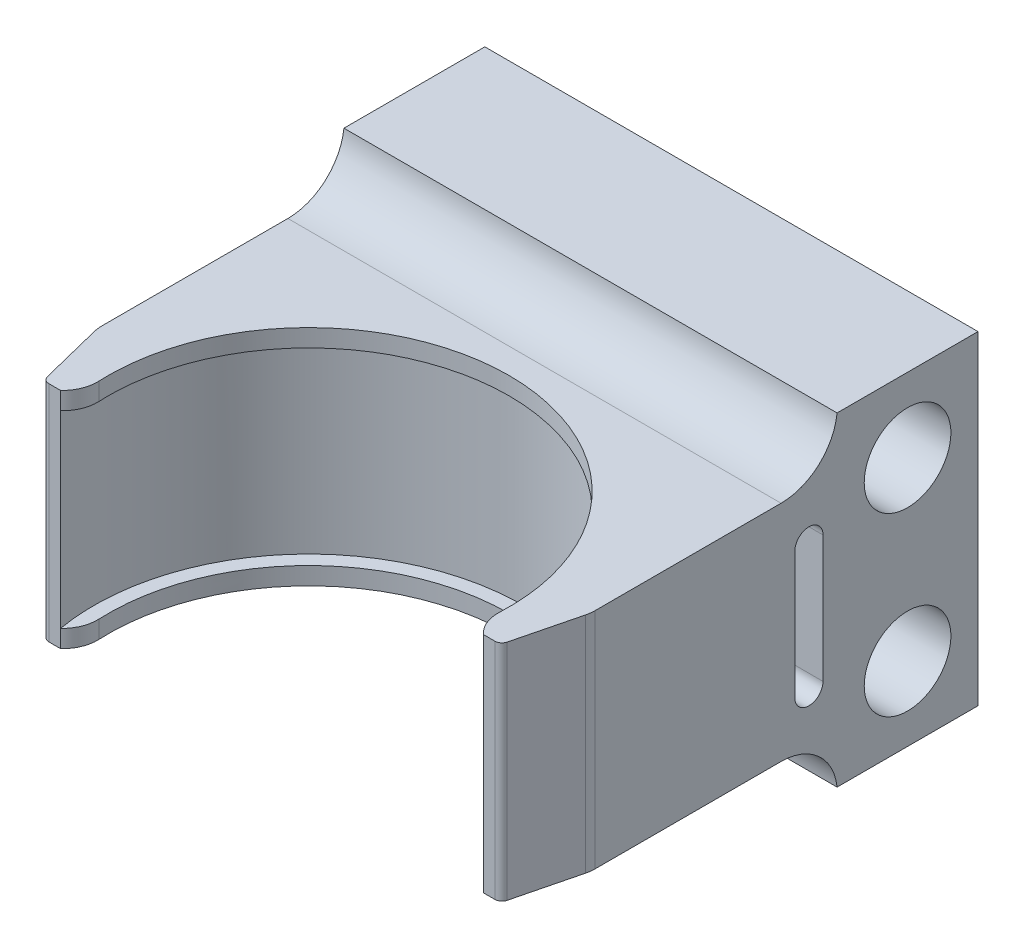
from build123d import *

# Parameters (mm, degrees)
BOSS_EXTRUDE2_DEPTH = 46
SKETCH4_R           = 6.15
CUT_EXTRUDE1_DEPTH  = 104.033974979
SKETCH6_W           = 45.215601595
SKETCH6_H           = 7.125
CUT_EXTRUDE2_DEPTH  = 104.033974979
CUT_EXTRUDE3_DEPTH  = 104.033974979
FILLET1_R           = 8
THICKEN1_START      = 7.125
THICKEN1_DEPTH      = 2.5
THICKEN2_START      = 36.375
THICKEN2_DEPTH      = 2.5
FILLET3_START       = 6
FILLET3_DEPTH       = 34
FILLET4_R           = 1


with BuildPart() as part:
    # Sketch3 → Boss-Extrude2 (new body)
    with BuildSketch(Plane(origin=(0, 0, 0), x_dir=(1, 0, 0), z_dir=(0, 1, 0))):
        with BuildLine():
            Line((35, 5.035917613), (35, 60))
            Line((35, 60), (-35, 60))
            Line((-35, 60), (-35, 5.035917613))
            Line((-35, 5.035917613), (-32.437862919, -5.215601595))
            Line((-32.437862919, -5.215601595), (-30, -5.215601595))
            ThreePointArc((-30, -5.215601595), (0, 30.45), (30, -5.215601595))
            Line((30, -5.215601595), (32.437862919, -5.215601595))
            Line((32.437862919, -5.215601595), (35, 5.035917613))
        make_face()
    extrude(amount=BOSS_EXTRUDE2_DEPTH)

    # Sketch4 → Cut-Extrude1 (cut, through all)
    with BuildSketch(Plane.ZY.offset(35)):
        with Locations((-50, 35.5)):
            Circle(SKETCH4_R)
        with Locations((-50, 10.5)):
            Circle(SKETCH4_R)
    extrude(amount=-CUT_EXTRUDE1_DEPTH, mode=Mode.SUBTRACT)

    # Sketch6 → Cut-Extrude2 (cut, through all)
    with BuildSketch(Plane.ZY.offset(35)):
        with Locations((-17.392199202, 42.4375)):
            Rectangle(SKETCH6_W, SKETCH6_H)
        with Locations((-17.392199202, 3.5625)):
            Rectangle(SKETCH6_W, SKETCH6_H)
    extrude(amount=-CUT_EXTRUDE2_DEPTH, mode=Mode.SUBTRACT)

    # Sketch7 → Cut-Extrude3 (cut, through all)
    with BuildSketch(Plane.ZY.offset(35)):
        with BuildLine():
            Line((-34, 32), (-34, 14))
            ThreePointArc((-34, 14), (-36, 12), (-38, 14))
            Line((-38, 14), (-38, 32))
            ThreePointArc((-38, 32), (-36, 34), (-34, 32))
        make_face()
    extrude(amount=-CUT_EXTRUDE3_DEPTH, mode=Mode.SUBTRACT)

    # Fillet1
    # the kernel refuses this fillet: 8 mm, written as the material it adds along each edge
    with BuildSketch(Plane(origin=(-35, 38.875, -40), x_dir=(0, 0, 1), z_dir=(1, 0, 0))) as fillet1_piece_1:
        with BuildLine():
            CenterArc((7.952004464, -8), FILLET1_R, 90, 83.720711677)
            Line((0, -7.125), (-0.159040089, -7.1075))
            ThreePointArc((-0.159040089, -7.1075), (-0.16, -3.5625), (-0.16, 0))
            Line((-0.16, 0), (0, 0.16))
            Line((0, 0.16), (7.952004464, 0.16))
            Line((7.952004464, 0.16), (7.952004464, 0))
        make_face()
    extrude(amount=70)
    with BuildSketch(Plane(origin=(-35, 7.125, -40), x_dir=(0, 0, 1), z_dir=(1, 0, 0))) as fillet1_piece_2:
        with BuildLine():
            CenterArc((7.952004464, 8), FILLET1_R, 186.279288323, 83.720711677)
            Line((0, 7.125), (-0.159040089, 7.1075))
            ThreePointArc((-0.159040089, 7.1075), (-0.16, 3.5625), (-0.16, 0))
            Line((-0.16, 0), (0, -0.16))
            Line((0, -0.16), (7.952004464, -0.16))
            Line((7.952004464, -0.16), (7.952004464, 0))
        make_face()
    extrude(amount=70)

    # Thicken1: read off the stored shape, not the designer's step
    # Thicken1 outline → Thicken1 (add)
    with BuildSketch(Plane(origin=(0, 0, 0), x_dir=(1, 0, 0), z_dir=(0, 1, 0)).offset(THICKEN1_START)):
        with BuildLine():
            Line((-30, -5.215601595), (-28.02955665, -4.873033346))
            add(Edge.make_bspline(
                [(-28.02955665, -4.873033346), (-28.098227513, -4.44491985), (-28.235569238, -3.588692857), (-28.415182418, -1.817508912), (-28.523288215, 1.384964463), (-27.97944925, 6.199907689), (-26.040449122, 12.009579762), (-22.790232653, 17.418782717), (-18.402164664, 21.998309903), (-11.490033606, 26.589068444), (-4.952214398, 28.293358132), (-0.733661392, 28.45), (0.733661392, 28.45), (4.952214398, 28.293358132), (11.490033606, 26.589068444), (18.402164664, 21.998309903), (22.790232653, 17.418782717), (26.040449122, 12.009579762), (27.97944925, 6.199907689), (28.523288215, 1.384964463), (28.415182418, -1.817508912), (28.235569238, -3.588692857), (28.098227513, -4.44491985), (28.02955665, -4.873033346)],
                knots=[0, 0, 0, 0, 0.01484375, 0.0296875, 0.059375, 0.11875, 0.178125, 0.2375, 0.296875, 0.35625, 0.475, 0.5, 0.5, 0.525, 0.64375, 0.703125, 0.7625, 0.821875, 0.88125, 0.940625, 0.9703125, 0.98515625, 1, 1, 1, 1], degree=3))
            Line((28.02955665, -4.873033346), (30, -5.215601595))
            ThreePointArc((30, -5.215601595), (0, 30.45), (-30, -5.215601595))
        make_face()
    extrude(amount=THICKEN1_DEPTH)

    # Thicken2: read off the stored shape, not the designer's step
    # Thicken2 outline → Thicken2 (add)
    with BuildSketch(Plane(origin=(0, 0, 0), x_dir=(1, 0, 0), z_dir=(0, 1, 0)).offset(THICKEN2_START)):
        with BuildLine():
            add(Edge.make_bspline(
                [(28.02955665, -4.873033346), (28.098227513, -4.44491985), (28.235569238, -3.588692857), (28.415182418, -1.817508912), (28.523288215, 1.384964463), (27.97944925, 6.199907689), (26.040449122, 12.009579762), (22.790232653, 17.418782717), (18.402164664, 21.998309903), (11.490033606, 26.589068444), (4.952214398, 28.293358132), (0.733661392, 28.45), (-0.733661392, 28.45), (-4.952214398, 28.293358132), (-11.490033606, 26.589068444), (-18.402164664, 21.998309903), (-22.790232653, 17.418782717), (-26.040449122, 12.009579762), (-27.97944925, 6.199907689), (-28.523288215, 1.384964463), (-28.415182418, -1.817508912), (-28.235569238, -3.588692857), (-28.098227513, -4.44491985), (-28.02955665, -4.873033346)],
                knots=[0, 0, 0, 0, 0.01484375, 0.0296875, 0.059375, 0.11875, 0.178125, 0.2375, 0.296875, 0.35625, 0.475, 0.5, 0.5, 0.525, 0.64375, 0.703125, 0.7625, 0.821875, 0.88125, 0.940625, 0.9703125, 0.98515625, 1, 1, 1, 1], degree=3))
            Line((28.02955665, -4.873033346), (30, -5.215601595))
            ThreePointArc((30, -5.215601595), (0, 30.45), (-30, -5.215601595))
            Line((-30, -5.215601595), (-28.02955665, -4.873033346))
        make_face()
    extrude(amount=THICKEN2_DEPTH)

    # Fillet3: read off the stored shape, not the designer's step
    # Fillet3 outline → Fillet3 (cut)
    with BuildSketch(Plane(origin=(0, 0, 0), x_dir=(1, 0, 0), z_dir=(0, 1, 0)).offset(FILLET3_START)):
        with BuildLine():
            Line((35, 5.035917613), (35, 5.651272685))
            ThreePointArc((35, 5.651272685), (34.962558609, 5.040525563), (34.850795181, 4.438925329))
            Line((34.850795181, 4.438925329), (35, 5.035917613))
        make_face()
        with BuildLine():
            Line((-35, 5.035917613), (-34.850795181, 4.438925329))
            ThreePointArc((-34.850795181, 4.438925329), (-34.962558609, 5.040525563), (-35, 5.651272685))
            Line((-35, 5.651272685), (-35, 5.035917613))
        make_face()
        with BuildLine():
            add(Edge.make_bspline(
                [(-28.02955665, -4.873033346), (-28.098227513, -4.44491985), (-28.235569238, -3.588692857), (-28.356138896, -2.399743128), (-28.403921261, -1.639675399), (-28.418446433, -1.328505626)],
                knots=[0, 0, 0, 0, 0.01484375, 0.0296875, 0.039856894, 0.039856894, 0.039856894, 0.039856894], degree=3))
            ThreePointArc((-28.418446433, -1.328505626), (-28.781681481, -3.446008708), (-30, -5.215601595))
            Line((-30, -5.215601595), (-28.02955665, -4.873033346))
        make_face()
        with BuildLine():
            ThreePointArc((30, -5.215601595), (28.781681481, -3.446008708), (28.418446433, -1.328505626))
            add(Edge.make_bspline(
                [(28.418446433, -1.328505626), (28.403921261, -1.639675399), (28.356138896, -2.399743128), (28.235569238, -3.588692857), (28.098227513, -4.44491985), (28.02955665, -4.873033346)],
                knots=[0.960143106, 0.960143106, 0.960143106, 0.960143106, 0.9703125, 0.98515625, 1, 1, 1, 1], degree=3))
            Line((28.02955665, -4.873033346), (30, -5.215601595))
        make_face()
    extrude(amount=FILLET3_DEPTH, mode=Mode.SUBTRACT)

    # Fillet4
    fillet4_edges = [part.edges().sort_by_distance(p)[0] for p in [
        (-32.437862919, 23, 5.215601595),
        (32.437862919, 23, 5.215601595),
    ]]
    fillet(fillet4_edges, radius=FILLET4_R)


solid = part.part
